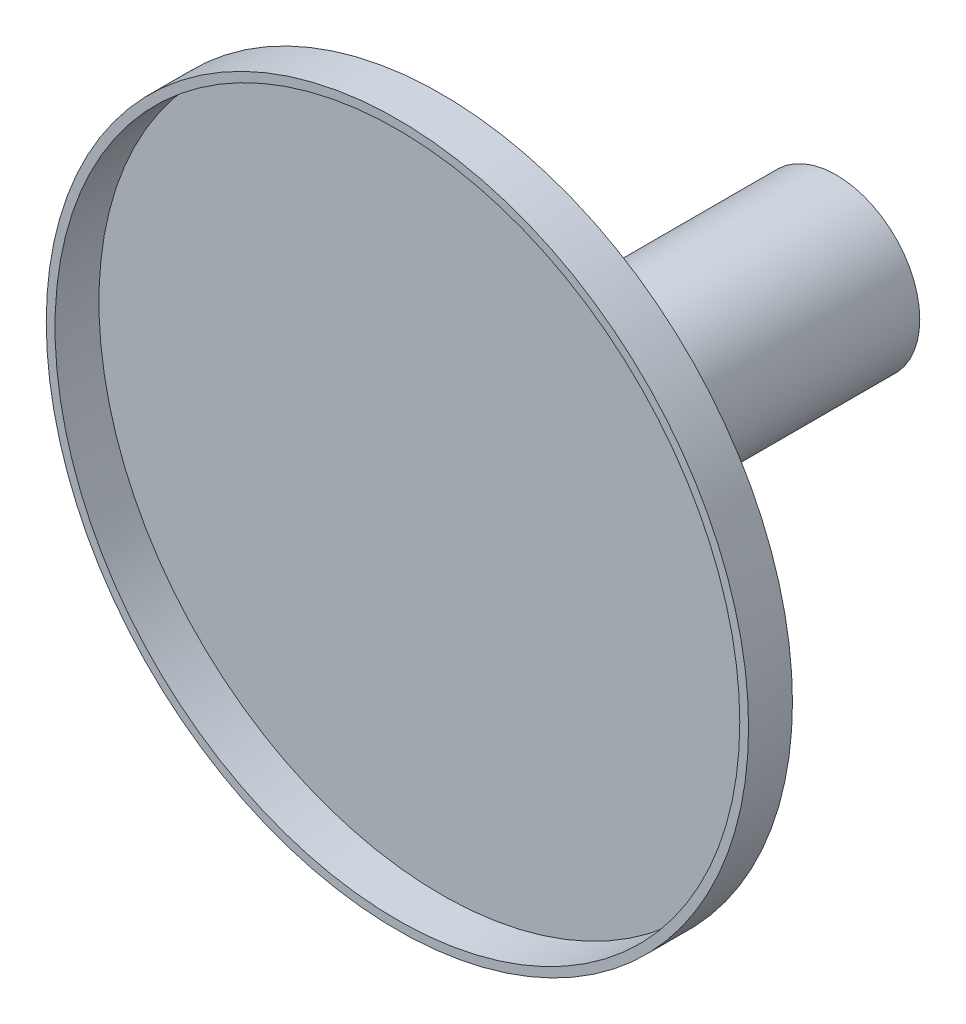
from build123d import *

# Parameters (mm, degrees)
SKETCH1_R           = 101.6
BOSS_EXTRUDE1_DEPTH = 12.7
SKETCH4_R           = 99.06
CUT_EXTRUDE1_DEPTH  = 38.1
SKETCH6_R           = 24.13
SKETCH6_R_2         = 20.828
BOSS_EXTRUDE2_DEPTH = 76.2


with BuildPart() as part:
    # Sketch1 → Boss-Extrude1 (new body)
    with BuildSketch(Plane.XY):
        Circle(SKETCH1_R)
    extrude(amount=BOSS_EXTRUDE1_DEPTH)

    # Sketch4 → Cut-Extrude1 (cut)
    with BuildSketch(Plane.XY.offset(12.7)):
        Circle(SKETCH4_R)
    extrude(amount=-CUT_EXTRUDE1_DEPTH, mode=Mode.SUBTRACT)



with BuildPart() as body_2:
    # Sketch6 → Boss-Extrude2 (new body)
    with BuildSketch(Plane(origin=(0, 0, -38.1), x_dir=(-1, 0, 0), z_dir=(0, 0, -1))):
        with Locations(Location((0, 0, 0), (0, 0, 180))):
            Circle(SKETCH6_R)
        with Locations(Location((0, 0, 0), (0, 0, 180))):
            Circle(SKETCH6_R_2, mode=Mode.SUBTRACT)
    extrude(amount=BOSS_EXTRUDE2_DEPTH)


with BuildPart() as part_1:
    add(part.part)

    add(body_2.part)  # Loft2 merges body 2
    # Loft2: read off the stored shape, not the designer's step
    # Loft2 outline → Loft2 (revolve)
    with BuildSketch(Plane.XZ):
        Polygon((101.6, 0), (0, 0), (0, -38.1), (24.13, -38.1), align=None)
    revolve(axis=Axis((0, 0, 0), (0, 0, 1)))


solid = part_1.part
